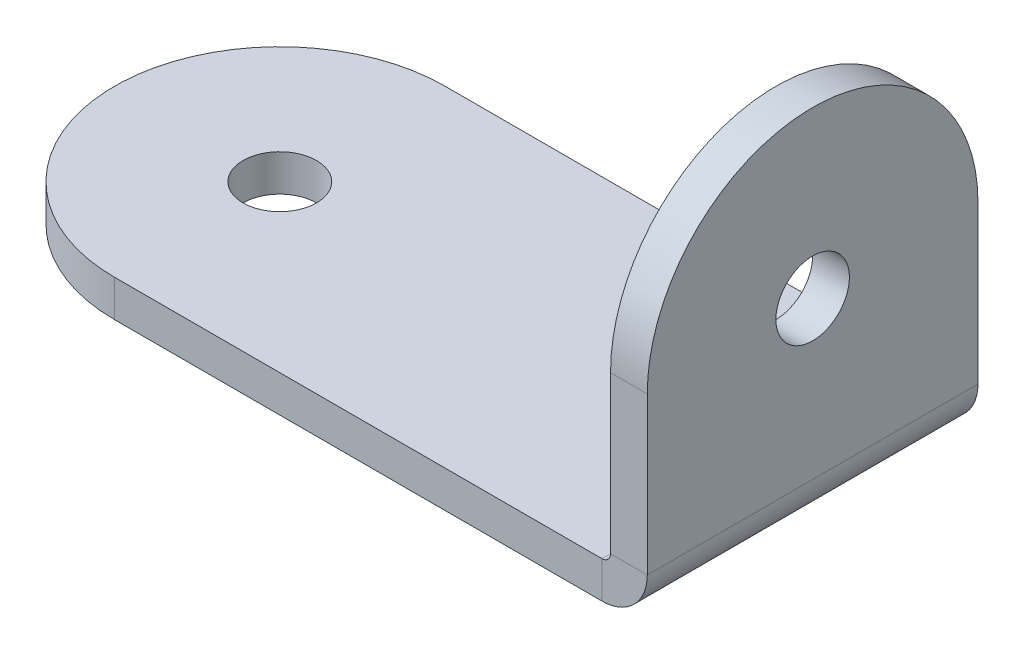
from build123d import *

# Parameters (mm, degrees)
BASE_FLANGE1_DEPTH = 14.2875
SKETCH6_R          = 3.175
CUT_EXTRUDE1_DEPTH = 66.473550242
SKETCH7_R          = 3.175
CUT_EXTRUDE2_DEPTH = 66.473550242
FILLET2_RADIUS     = 14.2875
FILLET2_LENGTH     = 3.175
FILLET3_RADIUS     = 14.2875
FILLET3_LENGTH     = 3.175


# Sheet-metal steps are written as plain solids
with BuildPart() as part:
    # Sketch1 → Base-Flange1 (new, symmetric)
    with BuildSketch(Plane.XY):
        with BuildLine():
            Line((0, 28.575), (0, 0.7366))
            ThreePointArc((0, 0.7366), (-0.215745145, 0.215745145), (-0.7366, 0))
            Line((-0.7366, 0), (-57.15, 0))
            Line((-57.15, 0), (-57.15, -3.175))
            Line((-57.15, -3.175), (-0.7366, -3.175))
            ThreePointArc((-0.7366, -3.175), (2.029318885, -2.029318885), (3.175, 0.7366))
            Line((3.175, 0.7366), (3.175, 28.575))
            Line((3.175, 28.575), (0, 28.575))
        make_face()
    extrude(amount=BASE_FLANGE1_DEPTH, both=True)

    # Sketch6 → Cut-Extrude1 (cut, through all)
    with BuildSketch(Plane(origin=(0, 0, 0), x_dir=(1, 0, 0), z_dir=(0, 1, 0))):
        with Locations(Location((-42.8625, 0, 0), (0, 0, 180))):
            Circle(SKETCH6_R)
    extrude(amount=-CUT_EXTRUDE1_DEPTH, mode=Mode.SUBTRACT)

    # Sketch7 → Cut-Extrude2 (cut, through all)
    with BuildSketch(Plane.ZY):
        with Locations((0, 14.2875)):
            Circle(SKETCH7_R)
    extrude(amount=-CUT_EXTRUDE2_DEPTH, mode=Mode.SUBTRACT)

    # Fillet2: full round fillet: the end face becomes a half cylinder, R = half its width
    fillet2_face = Plane((-57.15, -1.5875, 0), x_dir=(0, 1, 0), z_dir=(-1, 0, 0))  # on the end face: x along it, z out of the body
    fillet2_slab = fillet2_face.offset(-FILLET2_RADIUS / 2) * Box(FILLET2_LENGTH, 2 * FILLET2_RADIUS, FILLET2_RADIUS, mode=Mode.PRIVATE)  # the body's end, R deep
    fillet2_round = Plane((-42.8625, -1.5875, 0), x_dir=(-1, 0, 0), z_dir=(0, 1, 0)) * Cylinder(FILLET2_RADIUS, FILLET2_LENGTH, mode=Mode.PRIVATE)  # its axis R under the face
    add(fillet2_slab - fillet2_round, mode=Mode.SUBTRACT)

    # Fillet3: full round fillet: the end face becomes a half cylinder, R = half its width
    fillet3_face = Plane((1.5875, 28.575, 0), x_dir=(1, 0, 0), z_dir=(0, 1, 0))  # on the end face: x along it, z out of the body
    fillet3_slab = fillet3_face.offset(-FILLET3_RADIUS / 2) * Box(FILLET3_LENGTH, 2 * FILLET3_RADIUS, FILLET3_RADIUS, mode=Mode.PRIVATE)  # the body's end, R deep
    fillet3_round = Plane((1.5875, 14.2875, 0), x_dir=(0, 1, 0), z_dir=(1, 0, 0)) * Cylinder(FILLET3_RADIUS, FILLET3_LENGTH, mode=Mode.PRIVATE)  # its axis R under the face
    add(fillet3_slab - fillet3_round, mode=Mode.SUBTRACT)


solid = part.part
